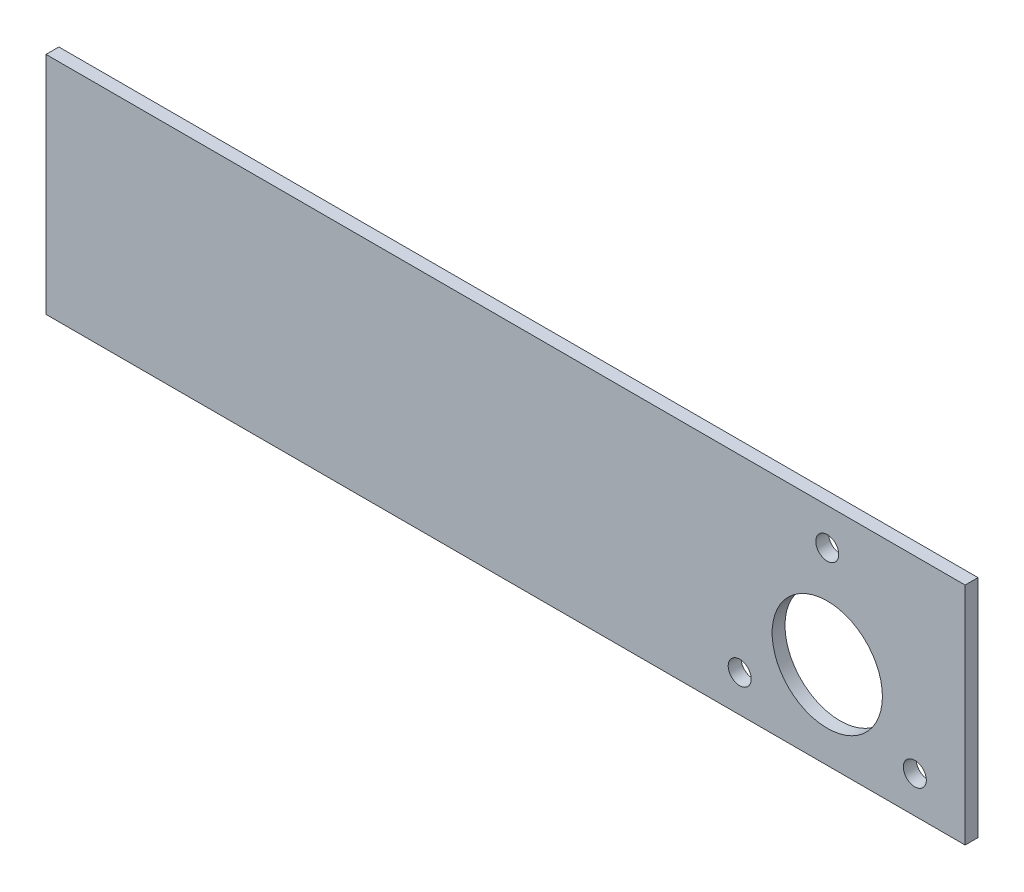
from build123d import *

# Parameters (mm, degrees)
SKETCH2_W          = 100
SKETCH2_H          = 24.5
BASE_FLANGE1_DEPTH = 1.4
SKETCH1_R          = 1.25
SKETCH1_R_2        = 6
CUT_EXTRUDE1_DEPTH = 10


# Sheet-metal steps are written as plain solids
with BuildPart() as part:
    # Sketch2 → Base-Flange1 (new body)
    with BuildSketch(Plane.XY):
        with Locations((-35, 2.75)):
            Rectangle(SKETCH2_W, SKETCH2_H)
    extrude(amount=-BASE_FLANGE1_DEPTH)

    # Sketch1 → Cut-Extrude1 (cut)
    with BuildSketch(Plane.XY):
        with Locations((0, 11)):
            Circle(SKETCH1_R)
        with Locations((-9.526279442, -5.5)):
            Circle(SKETCH1_R)
        with Locations((9.526279442, -5.5)):
            Circle(SKETCH1_R)
        Circle(SKETCH1_R_2)
    extrude(amount=-CUT_EXTRUDE1_DEPTH, mode=Mode.SUBTRACT)


solid = part.part
